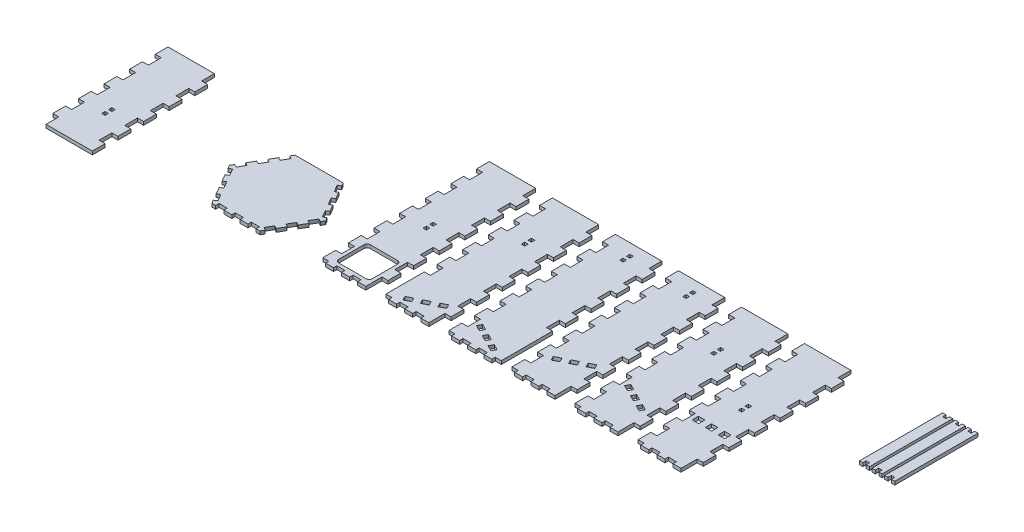
from build123d import *

# Parameters (mm, degrees)
BOSS_EXTRUDE3_DEPTH    = 3.2
SKETCH1_W              = 3.2
SKETCH1_H              = 3.2
BOSS_EXTRUDE3_2_DEPTH  = 3.2
BOSS_EXTRUDE3_3_DEPTH  = 3.2
BOSS_EXTRUDE3_4_DEPTH  = 3.2
BOSS_EXTRUDE3_5_DEPTH  = 3.2
BOSS_EXTRUDE3_6_DEPTH  = 3.2
SKETCH1_W_2            = 6.2
SKETCH1_H_2            = 6
BOSS_EXTRUDE3_7_DEPTH  = 3.2
BOSS_EXTRUDE3_8_DEPTH  = 3.2
BOSS_EXTRUDE3_9_DEPTH  = 3.2
BOSS_EXTRUDE3_10_DEPTH = 3.2
BOSS_EXTRUDE3_11_DEPTH = 3.2


with BuildPart() as part:
    # Sketch1 → Boss-Extrude3 (new body)
    with BuildSketch(Plane(origin=(0, 0, 0), x_dir=(1, 0, 0), z_dir=(0, 1, 0))):
        Polygon((-22.869998863, -39.612), (-19.17495714, -39.612), (-19.17495714, -36.412), (-11.504974284, -36.412), (-11.504974284, -39.612), (-3.834991428, -39.612), (-3.834991428, -36.412), (3.834991428, -36.412), (3.834991428, -39.612), (11.504974284, -39.612), (11.504974284, -36.412), (19.17495714, -36.412), (19.17495714, -39.612), (22.869998863, -39.612), (24.717519725, -36.412), (21.946238432, -34.812), (25.781229861, -28.1696), (28.552511153, -29.7696), (32.387502581, -23.1272), (29.616221289, -21.5272), (33.451212717, -14.8848), (36.222494009, -16.4848), (40.057485437, -9.8424), (37.286204145, -8.2424), (41.121195573, -1.6), (43.892476865, -3.2), (45.739997726, 0), (43.892476865, 3.2), (41.121195573, 1.6), (37.286204145, 8.2424), (40.057485437, 9.8424), (36.222494009, 16.4848), (33.451212717, 14.8848), (29.616221289, 21.5272), (32.387502581, 23.1272), (28.552511153, 29.7696), (25.781229861, 28.1696), (21.946238432, 34.812), (24.717519725, 36.412), (22.869998863, 39.612), (-22.869998863, 39.612), (-24.717519725, 36.412), (-21.946238432, 34.812), (-25.781229861, 28.1696), (-28.552511153, 29.7696), (-32.387502581, 23.1272), (-29.616221289, 21.5272), (-33.451212717, 14.8848), (-36.222494009, 16.4848), (-40.057485437, 9.8424), (-37.286204145, 8.2424), (-41.121195573, 1.6), (-43.892476865, 3.2), (-45.739997726, 0), (-43.892476865, -3.2), (-41.121195573, -1.6), (-37.286204145, -8.2424), (-40.057485437, -9.8424), (-36.222494009, -16.4848), (-33.451212717, -14.8848), (-29.616221289, -21.5272), (-32.387502581, -23.1272), (-28.552511153, -29.7696), (-25.781229861, -28.1696), (-21.946238432, -34.812), (-24.717519725, -36.412), align=None)
    extrude(amount=BOSS_EXTRUDE3_DEPTH)


with BuildPart() as body_2:
    # Sketch1 → Boss-Extrude3 2 (new body)
    with BuildSketch(Plane(origin=(0, 0, 0), x_dir=(1, 0, 0), z_dir=(0, 1, 0))):
        Polygon((80.552757397, -34.879378177), (88.222740254, -34.879378177), (88.222740254, -31.679378177), (95.89272311, -31.679378177), (95.89272311, -34.879378177), (103.562705966, -34.879378177), (103.562705966, -31.679378177), (111.232688822, -31.679378177), (111.232688822, -34.879378177), (118.902671678, -34.879378177), (118.902671678, -19.491070485), (124.645234262, -19.491070485), (124.645234262, -7.302762793), (118.902671678, -7.302762793), (118.902671678, 4.8855449), (124.645234262, 4.8855449), (124.645234262, 17.073852592), (118.902671678, 17.073852592), (118.902671678, 29.262160284), (124.645234262, 29.262160284), (124.645234262, 41.450467977), (118.902671678, 41.450467977), (118.902671678, 53.638775669), (124.645234262, 53.638775669), (124.645234262, 65.827083361), (118.902671678, 65.827083361), (118.902671678, 78.015391054), (124.645234262, 78.015391054), (124.645234262, 90.203698746), (118.902671678, 90.203698746), (118.902671678, 102.392006438), (124.645234262, 102.392006438), (124.645234262, 114.58031413), (118.902671678, 114.58031413), (118.902671678, 126.768621823), (74.810194813, 126.768621823), (74.810194813, 114.58031413), (80.552757397, 114.58031413), (80.552757397, 102.392006438), (74.810194813, 102.392006438), (74.810194813, 90.203698746), (80.552757397, 90.203698746), (80.552757397, 78.015391054), (74.810194813, 78.015391054), (74.810194813, 65.827083361), (80.552757397, 65.827083361), (80.552757397, 53.638775669), (74.810194813, 53.638775669), (74.810194813, 41.450467977), (80.552757397, 41.450467977), (80.552757397, 29.262160284), (74.810194813, 29.262160284), (74.810194813, 17.073852592), (80.552757397, 17.073852592), (80.552757397, 4.8855449), (74.810194813, 4.8855449), (74.810194813, -7.302762793), (80.552757397, -7.302762793), (80.552757397, -19.491070485), (74.810194813, -19.491070485), (74.810194813, -31.679378177), (80.552757397, -31.679378177), align=None)
        with BuildLine():
            Line((86.752757397, 1.520621823), (112.702671678, 1.520621823))
            ThreePointArc((112.702671678, 1.520621823), (114.823992022, 0.641942166), (115.702671678, -1.479378177))
            Line((115.702671678, -1.479378177), (115.702671678, -25.479378177))
            ThreePointArc((115.702671678, -25.479378177), (114.823992022, -27.600698521), (112.702671678, -28.479378177))
            Line((112.702671678, -28.479378177), (86.752757397, -28.479378177))
            ThreePointArc((86.752757397, -28.479378177), (84.631437054, -27.600698521), (83.752757397, -25.479378177))
            Line((83.752757397, -25.479378177), (83.752757397, -1.479378177))
            ThreePointArc((83.752757397, -1.479378177), (84.631437054, 0.641942166), (86.752757397, 1.520621823))
        make_face(mode=Mode.SUBTRACT)
        with Locations((99.727714538, 41.960621823)):
            Rectangle(SKETCH1_W, SKETCH1_H, mode=Mode.SUBTRACT)
        with Locations((99.727714538, 48.360621823)):
            Rectangle(SKETCH1_W, SKETCH1_H, mode=Mode.SUBTRACT)
    extrude(amount=BOSS_EXTRUDE3_2_DEPTH)


with BuildPart() as body_3:
    # Sketch1 → Boss-Extrude3 3 (new body)
    with BuildSketch(Plane(origin=(0, 0, 0), x_dir=(1, 0, 0), z_dir=(0, 1, 0))):
        Polygon((140.552757397, -34.879378177), (148.222740254, -34.879378177), (148.222740254, -31.679378177), (155.89272311, -31.679378177), (155.89272311, -34.879378177), (163.562705966, -34.879378177), (163.562705966, -31.679378177), (171.232688822, -31.679378177), (171.232688822, -34.879378177), (178.902671678, -34.879378177), (178.902671678, -19.491070485), (184.645234262, -19.491070485), (184.645234262, -7.302762793), (178.902671678, -7.302762793), (178.902671678, 4.8855449), (184.645234262, 4.8855449), (184.645234262, 17.073852592), (178.902671678, 17.073852592), (178.902671678, 29.262160284), (184.645234262, 29.262160284), (184.645234262, 41.450467977), (178.902671678, 41.450467977), (178.902671678, 53.638775669), (184.645234262, 53.638775669), (184.645234262, 65.827083361), (178.902671678, 65.827083361), (178.902671678, 78.015391054), (184.645234262, 78.015391054), (184.645234262, 90.203698746), (178.902671678, 90.203698746), (178.902671678, 102.392006438), (184.645234262, 102.392006438), (184.645234262, 114.58031413), (178.902671678, 114.58031413), (178.902671678, 126.768621823), (134.810194813, 126.768621823), (134.810194813, 114.58031413), (140.552757397, 114.58031413), (140.552757397, 102.392006438), (134.810194813, 102.392006438), (134.810194813, 90.203698746), (140.552757397, 90.203698746), (140.552757397, 78.015391054), (134.810194813, 78.015391054), (134.810194813, 65.827083361), (140.552757397, 65.827083361), (140.552757397, 53.638775669), (134.810194813, 53.638775669), (134.810194813, 41.450467977), (140.552757397, 41.450467977), (140.552757397, 29.262160284), (134.810194813, 29.262160284), (134.810194813, 17.073852592), (140.552757397, 17.073852592), (140.552757397, 4.8855449), (134.810194813, 4.8855449), (134.810194813, -7.302762793), (134.810194813, -19.491070485), (134.810194813, -31.679378177), (140.552757397, -31.679378177), align=None)
        Polygon((145.863459219, -24.522323794), (151.409161346, -21.750106647), (153.376541257, -25.685766221), (147.83083913, -28.457983368), align=None, mode=Mode.SUBTRACT)
        Polygon((156.954863474, -18.977889499), (162.500565602, -16.205672352), (164.467945513, -20.141331927), (158.922243385, -22.913549074), align=None, mode=Mode.SUBTRACT)
        Polygon((168.046267729, -13.433455205), (173.591969857, -10.661238058), (175.559349768, -14.596897632), (170.01364764, -17.369114779), align=None, mode=Mode.SUBTRACT)
        with Locations((159.727714538, 75.560621823)):
            Rectangle(SKETCH1_W, SKETCH1_H, mode=Mode.SUBTRACT)
        with Locations((159.727714538, 81.960621823)):
            Rectangle(SKETCH1_W, SKETCH1_H, mode=Mode.SUBTRACT)
    extrude(amount=BOSS_EXTRUDE3_3_DEPTH)


with BuildPart() as body_4:
    # Sketch1 → Boss-Extrude3 4 (new body)
    with BuildSketch(Plane(origin=(0, 0, 0), x_dir=(1, 0, 0), z_dir=(0, 1, 0))):
        Polygon((200.552757397, -34.879378177), (208.222740254, -34.879378177), (208.222740254, -31.679378177), (215.89272311, -31.679378177), (215.89272311, -34.879378177), (223.562705966, -34.879378177), (223.562705966, -31.679378177), (231.232688822, -31.679378177), (231.232688822, -34.879378177), (238.902671678, -34.879378177), (238.902671678, -31.679378177), (244.645234262, -31.679378177), (244.645234262, -19.491070485), (244.645234262, -7.302762793), (244.645234262, 17.073852592), (238.902671678, 17.073852592), (238.902671678, 29.262160284), (244.645234262, 29.262160284), (244.645234262, 41.450467977), (238.902671678, 41.450467977), (238.902671678, 53.638775669), (244.645234262, 53.638775669), (244.645234262, 65.827083361), (238.902671678, 65.827083361), (238.902671678, 78.015391054), (244.645234262, 78.015391054), (244.645234262, 90.203698746), (238.902671678, 90.203698746), (238.902671678, 102.392006438), (244.645234262, 102.392006438), (244.645234262, 114.58031413), (238.902671678, 114.58031413), (238.902671678, 126.768621823), (194.810194813, 126.768621823), (194.810194813, 114.58031413), (200.552757397, 114.58031413), (200.552757397, 102.392006438), (194.810194813, 102.392006438), (194.810194813, 90.203698746), (200.552757397, 90.203698746), (200.552757397, 78.015391054), (194.810194813, 78.015391054), (194.810194813, 65.827083361), (200.552757397, 65.827083361), (200.552757397, 53.638775669), (194.810194813, 53.638775669), (194.810194813, 41.450467977), (200.552757397, 41.450467977), (200.552757397, 29.262160284), (194.810194813, 29.262160284), (194.810194813, 17.073852592), (200.552757397, 17.073852592), (200.552757397, 4.8855449), (194.810194813, 4.8855449), (194.810194813, -7.302762793), (200.552757397, -7.302762793), (200.552757397, -19.491070485), (194.810194813, -19.491070485), (194.810194813, -31.679378177), (200.552757397, -31.679378177), align=None)
        Polygon((205.863459219, -10.661238058), (203.896079308, -14.596897632), (209.441781435, -17.369114779), (211.409161346, -13.433455205), align=None, mode=Mode.SUBTRACT)
        Polygon((216.954863474, -16.205672352), (214.987483563, -20.141331927), (220.533185691, -22.913549074), (222.500565602, -18.977889499), align=None, mode=Mode.SUBTRACT)
        Polygon((228.046267729, -21.750106647), (226.078887818, -25.685766221), (231.624589946, -28.457983368), (233.591969857, -24.522323794), align=None, mode=Mode.SUBTRACT)
        with Locations((219.727714538, 109.160621823)):
            Rectangle(SKETCH1_W, SKETCH1_H, mode=Mode.SUBTRACT)
        with Locations((219.727714538, 115.560621823)):
            Rectangle(SKETCH1_W, SKETCH1_H, mode=Mode.SUBTRACT)
    extrude(amount=BOSS_EXTRUDE3_4_DEPTH)


with BuildPart() as body_5:
    # Sketch1 → Boss-Extrude3 5 (new body)
    with BuildSketch(Plane(origin=(0, 0, 0), x_dir=(1, 0, 0), z_dir=(0, 1, 0))):
        Polygon((260.552757397, -34.879378177), (268.222740254, -34.879378177), (268.222740254, -31.679378177), (275.89272311, -31.679378177), (275.89272311, -34.879378177), (283.562705966, -34.879378177), (283.562705966, -31.679378177), (291.232688822, -31.679378177), (291.232688822, -34.879378177), (298.902671678, -34.879378177), (298.902671678, -19.491070485), (304.645234262, -19.491070485), (304.645234262, -7.302762793), (298.902671678, -7.302762793), (298.902671678, 4.8855449), (304.645234262, 4.8855449), (304.645234262, 17.073852592), (298.902671678, 17.073852592), (298.902671678, 29.262160284), (304.645234262, 29.262160284), (304.645234262, 41.450467977), (298.902671678, 41.450467977), (298.902671678, 53.638775669), (304.645234262, 53.638775669), (304.645234262, 65.827083361), (298.902671678, 65.827083361), (298.902671678, 78.015391054), (304.645234262, 78.015391054), (304.645234262, 90.203698746), (298.902671678, 90.203698746), (298.902671678, 102.392006438), (304.645234262, 102.392006438), (304.645234262, 114.58031413), (298.902671678, 114.58031413), (298.902671678, 126.768621823), (254.810194813, 126.768621823), (254.810194813, 114.58031413), (260.552757397, 114.58031413), (260.552757397, 102.392006438), (254.810194813, 102.392006438), (254.810194813, 90.203698746), (260.552757397, 90.203698746), (260.552757397, 78.015391054), (254.810194813, 78.015391054), (254.810194813, 65.827083361), (260.552757397, 65.827083361), (260.552757397, 53.638775669), (254.810194813, 53.638775669), (254.810194813, 41.450467977), (260.552757397, 41.450467977), (260.552757397, 29.262160284), (254.810194813, 29.262160284), (254.810194813, 17.073852592), (260.552757397, 17.073852592), (260.552757397, 4.8855449), (254.810194813, 4.8855449), (254.810194813, -7.302762793), (260.552757397, -7.302762793), (260.552757397, -19.491070485), (254.810194813, -19.491070485), (254.810194813, -31.679378177), (260.552757397, -31.679378177), align=None)
        Polygon((267.83083913, -7.437983368), (265.863459219, -3.502323794), (271.409161346, -0.730106647), (273.376541257, -4.665766221), align=None, mode=Mode.SUBTRACT)
        Polygon((276.954863474, 2.042110501), (278.922243385, -1.893549074), (284.467945513, 0.878668073), (282.500565602, 4.814327648), align=None, mode=Mode.SUBTRACT)
        Polygon((288.046267729, 7.586544795), (290.01364764, 3.650885221), (295.559349768, 6.423102368), (293.591969857, 10.358761942), align=None, mode=Mode.SUBTRACT)
        with Locations((279.727714538, 115.560621823)):
            Rectangle(SKETCH1_W, SKETCH1_H, mode=Mode.SUBTRACT)
        with Locations((279.727714538, 109.160621823)):
            Rectangle(SKETCH1_W, SKETCH1_H, mode=Mode.SUBTRACT)
    extrude(amount=BOSS_EXTRUDE3_5_DEPTH)


with BuildPart() as body_6:
    # Sketch1 → Boss-Extrude3 6 (new body)
    with BuildSketch(Plane(origin=(0, 0, 0), x_dir=(1, 0, 0), z_dir=(0, 1, 0))):
        Polygon((320.552757397, -34.879378177), (328.222740254, -34.879378177), (328.222740254, -31.679378177), (335.89272311, -31.679378177), (335.89272311, -34.879378177), (343.562705966, -34.879378177), (343.562705966, -31.679378177), (351.232688822, -31.679378177), (351.232688822, -34.879378177), (358.902671678, -34.879378177), (358.902671678, -19.491070485), (364.645234262, -19.491070485), (364.645234262, -7.302762793), (358.902671678, -7.302762793), (358.902671678, 4.8855449), (364.645234262, 4.8855449), (364.645234262, 17.073852592), (358.902671678, 17.073852592), (358.902671678, 29.262160284), (364.645234262, 29.262160284), (364.645234262, 41.450467977), (358.902671678, 41.450467977), (358.902671678, 53.638775669), (364.645234262, 53.638775669), (364.645234262, 65.827083361), (358.902671678, 65.827083361), (358.902671678, 78.015391054), (364.645234262, 78.015391054), (364.645234262, 90.203698746), (358.902671678, 90.203698746), (358.902671678, 102.392006438), (364.645234262, 102.392006438), (364.645234262, 114.58031413), (358.902671678, 114.58031413), (358.902671678, 126.768621823), (314.810194813, 126.768621823), (314.810194813, 114.58031413), (320.552757397, 114.58031413), (320.552757397, 102.392006438), (314.810194813, 102.392006438), (314.810194813, 90.203698746), (320.552757397, 90.203698746), (320.552757397, 78.015391054), (314.810194813, 78.015391054), (314.810194813, 65.827083361), (320.552757397, 65.827083361), (320.552757397, 53.638775669), (314.810194813, 53.638775669), (314.810194813, 41.450467977), (320.552757397, 41.450467977), (320.552757397, 29.262160284), (314.810194813, 29.262160284), (314.810194813, 17.073852592), (320.552757397, 17.073852592), (320.552757397, 4.8855449), (314.810194813, 4.8855449), (314.810194813, -7.302762793), (320.552757397, -7.302762793), (320.552757397, -19.491070485), (314.810194813, -19.491070485), (314.810194813, -31.679378177), (320.552757397, -31.679378177), align=None)
        Polygon((325.863459219, 10.358761942), (331.409161346, 7.586544795), (329.441781435, 3.650885221), (323.896079308, 6.423102368), align=None, mode=Mode.SUBTRACT)
        Polygon((336.954863474, 4.814327648), (342.500565602, 2.042110501), (340.533185691, -1.893549074), (334.987483563, 0.878668073), align=None, mode=Mode.SUBTRACT)
        Polygon((346.078887818, -4.665766221), (351.624589946, -7.437983368), (353.591969857, -3.502323794), (348.046267729, -0.730106647), align=None, mode=Mode.SUBTRACT)
        with Locations((339.727714538, 81.960621823)):
            Rectangle(SKETCH1_W, SKETCH1_H, mode=Mode.SUBTRACT)
        with Locations((339.727714538, 75.560621823)):
            Rectangle(SKETCH1_W, SKETCH1_H, mode=Mode.SUBTRACT)
    extrude(amount=BOSS_EXTRUDE3_6_DEPTH)


with BuildPart() as body_7:
    # Sketch1 → Boss-Extrude3 7 (new body)
    with BuildSketch(Plane(origin=(0, 0, 0), x_dir=(1, 0, 0), z_dir=(0, 1, 0))):
        Polygon((380.552757397, -34.879378177), (388.222740254, -34.879378177), (388.222740254, -31.679378177), (395.89272311, -31.679378177), (395.89272311, -34.879378177), (403.562705966, -34.879378177), (403.562705966, -31.679378177), (411.232688822, -31.679378177), (411.232688822, -34.879378177), (418.902671678, -34.879378177), (418.902671678, -19.491070485), (424.645234262, -19.491070485), (424.645234262, -7.302762793), (418.902671678, -7.302762793), (418.902671678, 4.8855449), (424.645234262, 4.8855449), (424.645234262, 17.073852592), (418.902671678, 17.073852592), (418.902671678, 29.262160284), (424.645234262, 29.262160284), (424.645234262, 41.450467977), (418.902671678, 41.450467977), (418.902671678, 53.638775669), (424.645234262, 53.638775669), (424.645234262, 65.827083361), (418.902671678, 65.827083361), (418.902671678, 78.015391054), (424.645234262, 78.015391054), (424.645234262, 90.203698746), (418.902671678, 90.203698746), (418.902671678, 102.392006438), (424.645234262, 102.392006438), (424.645234262, 114.58031413), (418.902671678, 114.58031413), (418.902671678, 126.768621823), (374.810194813, 126.768621823), (374.810194813, 114.58031413), (380.552757397, 114.58031413), (380.552757397, 102.392006438), (374.810194813, 102.392006438), (374.810194813, 90.203698746), (380.552757397, 90.203698746), (380.552757397, 78.015391054), (374.810194813, 78.015391054), (374.810194813, 65.827083361), (380.552757397, 65.827083361), (380.552757397, 53.638775669), (374.810194813, 53.638775669), (374.810194813, 41.450467977), (380.552757397, 41.450467977), (380.552757397, 29.262160284), (374.810194813, 29.262160284), (374.810194813, 17.073852592), (380.552757397, 17.073852592), (380.552757397, 4.8855449), (374.810194813, 4.8855449), (374.810194813, -7.302762793), (380.552757397, -7.302762793), (380.552757397, -19.491070485), (374.810194813, -19.491070485), (374.810194813, -31.679378177), (380.552757397, -31.679378177), align=None)
        with Locations((387.327714538, 13.360621823)):
            Rectangle(SKETCH1_W_2, SKETCH1_H_2, mode=Mode.SUBTRACT)
        with Locations((399.727714538, 13.360621823)):
            Rectangle(SKETCH1_W_2, SKETCH1_H_2, mode=Mode.SUBTRACT)
        with Locations((412.127714538, 13.360621823)):
            Rectangle(SKETCH1_W_2, SKETCH1_H_2, mode=Mode.SUBTRACT)
        with Locations((399.727714538, 48.360621823)):
            Rectangle(SKETCH1_W, SKETCH1_H, mode=Mode.SUBTRACT)
        with Locations((399.727714538, 41.960621823)):
            Rectangle(SKETCH1_W, SKETCH1_H, mode=Mode.SUBTRACT)
    extrude(amount=BOSS_EXTRUDE3_7_DEPTH)


with BuildPart() as body_8:
    # Sketch1 → Boss-Extrude3 8 (new body)
    with BuildSketch(Plane(origin=(0, 0, 0), x_dir=(1, 0, 0), z_dir=(0, 1, 0))):
        Polygon((497.6107333, 135.403791421), (497.6107333, 56.183791421), (500.8107333, 56.183791421), (500.8107333, 59.383791421), (504.0107333, 59.383791421), (504.0107333, 56.183791421), (507.2107333, 56.183791421), (507.2107333, 135.403791421), (504.0107333, 135.403791421), (504.0107333, 132.203791421), (500.8107333, 132.203791421), (500.8107333, 135.403791421), align=None)
    extrude(amount=BOSS_EXTRUDE3_8_DEPTH)


with BuildPart() as body_9:
    # Sketch1 → Boss-Extrude3 9 (new body)
    with BuildSketch(Plane(origin=(0, 0, 0), x_dir=(1, 0, 0), z_dir=(0, 1, 0))):
        Polygon((509.6107333, 135.403791421), (509.6107333, 56.183791421), (512.8107333, 56.183791421), (512.8107333, 59.383791421), (516.0107333, 59.383791421), (516.0107333, 56.183791421), (519.2107333, 56.183791421), (519.2107333, 135.403791421), (516.0107333, 135.403791421), (516.0107333, 132.203791421), (512.8107333, 132.203791421), (512.8107333, 135.403791421), align=None)
    extrude(amount=BOSS_EXTRUDE3_9_DEPTH)


with BuildPart() as body_10:
    # Sketch1 → Boss-Extrude3 10 (new body)
    with BuildSketch(Plane(origin=(0, 0, 0), x_dir=(1, 0, 0), z_dir=(0, 1, 0))):
        Polygon((521.6107333, 135.403791421), (521.6107333, 56.183791421), (524.8107333, 56.183791421), (524.8107333, 59.383791421), (528.0107333, 59.383791421), (528.0107333, 56.183791421), (531.2107333, 56.183791421), (531.2107333, 135.403791421), (528.0107333, 135.403791421), (528.0107333, 132.203791421), (524.8107333, 132.203791421), (524.8107333, 135.403791421), align=None)
    extrude(amount=BOSS_EXTRUDE3_10_DEPTH)


with BuildPart() as body_11:
    # Sketch1 → Boss-Extrude3 11 (new body)
    with BuildSketch(Plane(origin=(0, 0, 0), x_dir=(1, 0, 0), z_dir=(0, 1, 0))):
        Polygon((-166.784418938, -53.515832315), (-166.784418938, -41.327524623), (-172.526981522, -41.327524623), (-172.526981522, -29.139216931), (-166.784418938, -29.139216931), (-166.784418938, -16.950909238), (-172.526981522, -16.950909238), (-172.526981522, -4.762601546), (-166.784418938, -4.762601546), (-166.784418938, 7.425706146), (-172.526981522, 7.425706146), (-172.526981522, 19.614013839), (-166.784418938, 19.614013839), (-166.784418938, 31.802321531), (-172.526981522, 31.802321531), (-172.526981522, 43.990629223), (-166.784418938, 43.990629223), (-166.784418938, 56.178936916), (-172.526981522, 56.178936916), (-172.526981522, 68.367244608), (-128.434504658, 68.367244608), (-128.434504658, 56.178936916), (-122.691942073, 56.178936916), (-122.691942073, 43.990629223), (-128.434504658, 43.990629223), (-128.434504658, 31.802321531), (-122.691942073, 31.802321531), (-122.691942073, 19.614013839), (-128.434504658, 19.614013839), (-128.434504658, 7.425706146), (-122.691942073, 7.425706146), (-122.691942073, -4.762601546), (-128.434504658, -4.762601546), (-128.434504658, -16.950909238), (-122.691942073, -16.950909238), (-122.691942073, -29.139216931), (-128.434504658, -29.139216931), (-128.434504658, -41.327524623), (-122.691942073, -41.327524623), (-122.691942073, -53.515832315), align=None)
        with Locations((-147.609461798, -16.440755392)):
            Rectangle(SKETCH1_W, SKETCH1_H, mode=Mode.SUBTRACT)
        with Locations((-147.609461798, -10.040755392)):
            Rectangle(SKETCH1_W, SKETCH1_H, mode=Mode.SUBTRACT)
    extrude(amount=BOSS_EXTRUDE3_11_DEPTH)


solid = Compound([part.part, body_2.part, body_3.part, body_4.part, body_5.part, body_6.part, body_7.part, body_8.part, body_9.part, body_10.part, body_11.part])
